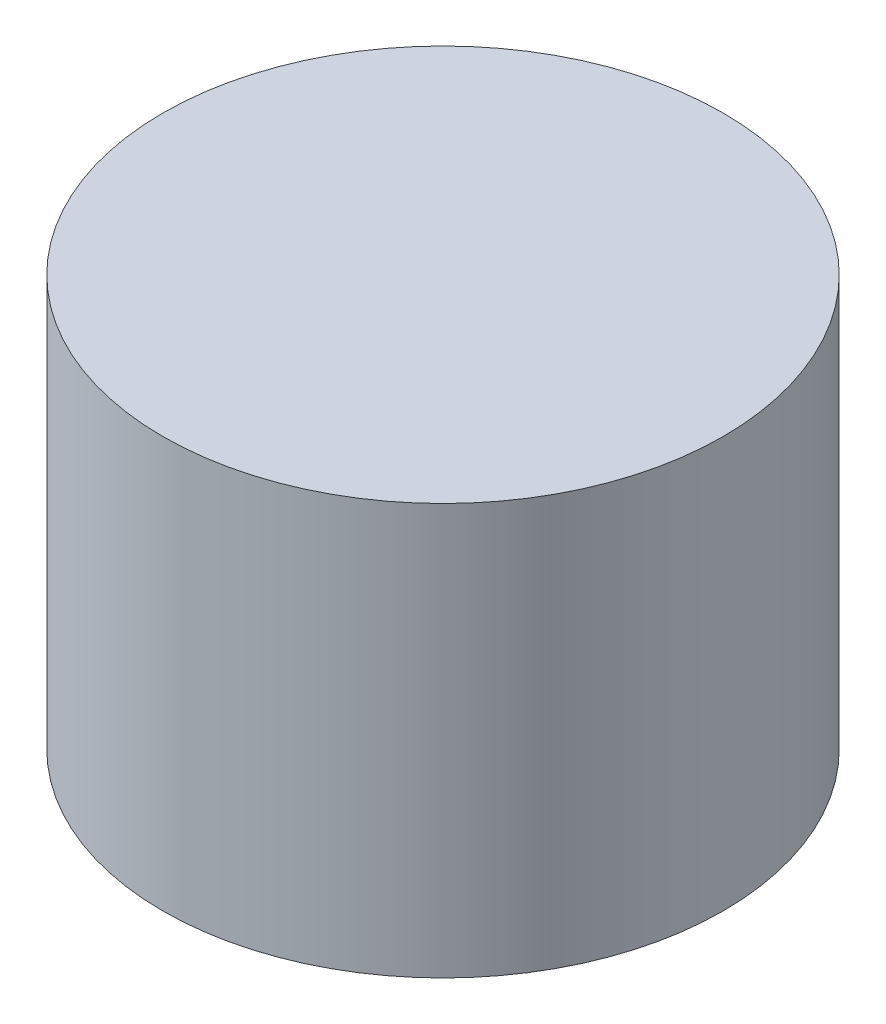
from build123d import *


with BuildPart() as part:
    # Schizzo1 → Rivoluzione1 (revolve)
    with BuildSketch(Plane.XY):
        Polygon((-12, 0), (-12, 16), (0, 16), (0, 22), (-15, 22), (-15, 0), align=None)
    revolve(axis=Axis((0, 0, 0), (0, 1, 0)))


solid = part.part
